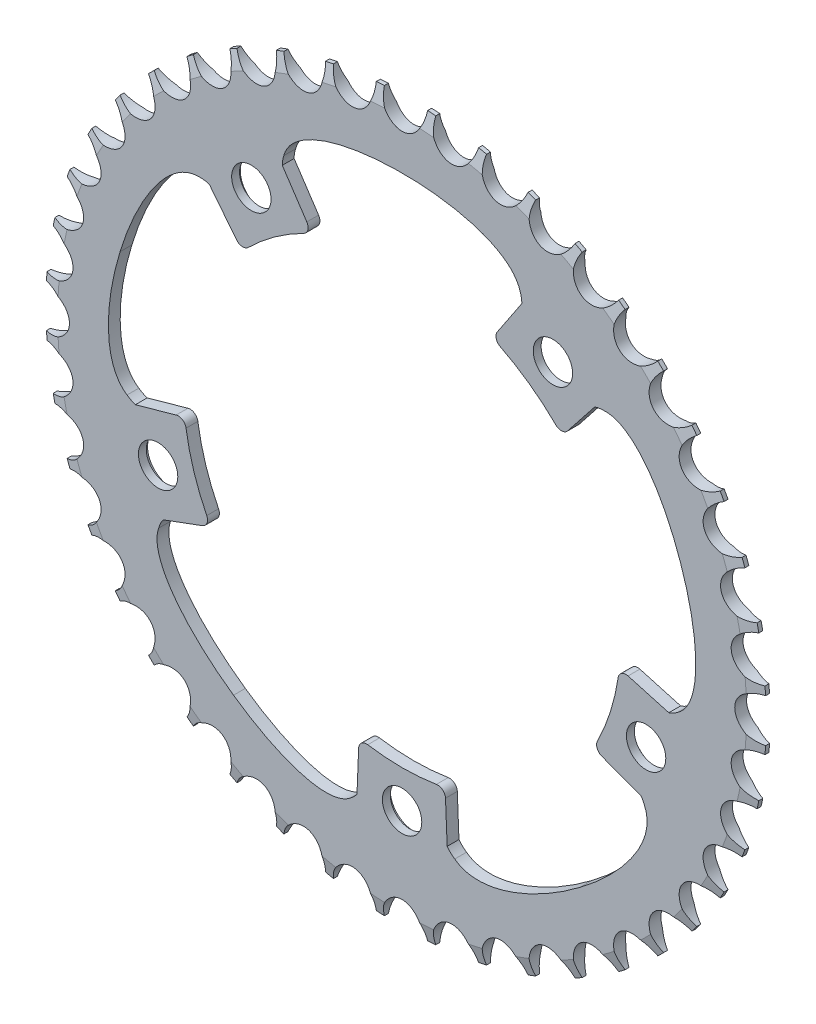
from build123d import *

# Parameters (mm, degrees)
SKETCH1_R                 = 91.5
BOSS_EXTRUDE1_DEPTH       = 3
CUT_EXTRUDE2_START        = -130.435312029
CUT_EXTRUDE2_DEPTH        = 133.435312029
CUT_EXTRUDE3_START        = -130.435312173
SKETCH6_R                 = 5
CUT_EXTRUDE3_DEPTH        = 133.435312173
SKETCH7_R                 = 6
CUT_EXTRUDE6_DEPTH        = 1
CIRPATTERN1_OUTLINE_R     = 5
CIRPATTERN1_DEPTH         = 3
CIRPATTERN1_2_OUTLINE_R   = 6
CIRPATTERN1_2_OUTLINE_R_2 = 5
CIRPATTERN1_2_DEPTH       = 1
SKETCH8_R                 = 55.5
CUT_EXTRUDE7_DEPTH        = 130.435312173
FILLET1_R                 = 2
CHAMFER1_SIZE             = 1
CHAMFER1_SIZE2            = 4
SKETCH11_RX               = 7
SKETCH11_RY               = 5.5
CUT_EXTRUDE8_DEPTH        = 130.435312031
CIRPATTERN2_COUNT         = 44


# Read off the part's stored shape, not the designer's step: CirPattern1
with BuildPart() as part:
    # Sketch1 → Boss-Extrude1 (new body)
    with BuildSketch(Plane.XY):
        Circle(SKETCH1_R)
    extrude(amount=BOSS_EXTRUDE1_DEPTH)

    # Sketch4 → Cut-Extrude2 (cut)
    with BuildSketch(Plane.XY.offset(CUT_EXTRUDE2_START)):
        with BuildLine():
            Line((0, 16.5), (30, 61.5))
            add(Edge.make_bspline(
                [(-30, 61.5), (-30, 78.833333333), (30, 78.833333333), (30, 61.5)],
                knots=[0, 0, 0, 0, 1, 1, 1, 1], degree=3))
            Line((-30, 61.5), (0, 16.5))
        make_face()
        with BuildLine():
            Line((15.692432519, 5.098780407), (49.219465921, 47.536240643))
            add(Edge.make_bspline(
                [(49.219465921, 47.536240643), (65.704445537, 52.892535212), (84.245465199, -4.170855766), (67.760485583, -9.527150335)],
                knots=[0, 0, 0, 0, 1, 1, 1, 1], degree=3))
            Line((67.760485583, -9.527150335), (15.692432519, 5.098780407))
        make_face()
        with BuildLine():
            Line((9.698456663, -13.348780407), (60.419302847, -32.120987585))
            add(Edge.make_bspline(
                [(60.419302847, -32.120987585), (70.607580554, -46.143948821), (22.066560891, -81.411063959), (11.878283185, -67.388102723)],
                knots=[0, 0, 0, 0, 1, 1, 1, 1], degree=3))
            Line((11.878283185, -67.388102723), (9.698456663, -13.348780407))
        make_face()
        with BuildLine():
            Line((-9.698456663, -13.348780407), (-11.878283185, -67.388102723))
            add(Edge.make_bspline(
                [(-11.878283185, -67.388102723), (-22.066560891, -81.411063959), (-70.607580554, -46.143948821), (-60.419302847, -32.120987585)],
                knots=[0, 0, 0, 0, 1, 1, 1, 1], degree=3))
            Line((-60.419302847, -32.120987585), (-9.698456663, -13.348780407))
        make_face()
        with BuildLine():
            Line((-15.692432519, 5.098780407), (-67.760485583, -9.527150335))
            add(Edge.make_bspline(
                [(-67.760485583, -9.527150335), (-84.245465199, -4.170855766), (-65.704445537, 52.892535212), (-49.219465921, 47.536240643)],
                knots=[0, 0, 0, 0, 1, 1, 1, 1], degree=3))
            Line((-49.219465921, 47.536240643), (-15.692432519, 5.098780407))
        make_face()
    extrude(amount=CUT_EXTRUDE2_DEPTH, mode=Mode.SUBTRACT)

    # Sketch6 → Cut-Extrude3 (cut)
    with BuildSketch(Plane.XY.offset(CUT_EXTRUDE3_START)):
        with Locations((0, -65)):
            Circle(SKETCH6_R)
    extrude(amount=CUT_EXTRUDE3_DEPTH, mode=Mode.SUBTRACT)

    # Sketch7 → Cut-Extrude6 (cut, symmetric)
    with BuildSketch(Plane.XY):
        with Locations((0, -65)):
            Circle(SKETCH7_R)
    extrude(amount=CUT_EXTRUDE6_DEPTH, both=True, mode=Mode.SUBTRACT)

    # CirPattern1 outline → CirPattern1 (cut)
    with BuildSketch(Plane.XY):
        with BuildLine():
            add(Edge.make_bspline(
                [(-48.970721556, 48.353460835), (-49.840452403, 48.636053518), (-50.71590626, 48.744900328), (-51.591637435, 48.69676138)],
                knots=[0, 0, 0, 0, 0.052758988, 0.052758988, 0.052758988, 0.052758988], degree=3))
            add(Edge.make_bspline(
                [(-51.591637435, 48.69676138), (-59.505190964, 48.838058389), (-67.53083451, 35.875195984), (-71.645584382, 22.189644727)],
                knots=[0.042157086, 0.042157086, 0.042157086, 0.042157086, 0.519094675, 0.519094675, 0.519094675, 0.519094675], degree=3))
            add(Edge.make_bspline(
                [(-71.645584382, 22.189644727), (-75.618498767, 9.294670273), (-76.153404073, -4.379467749), (-69.870454401, -8.430673202)],
                knots=[0.513223397, 0.513223397, 0.513223397, 0.513223397, 0.963256454, 0.963256454, 0.963256454, 0.963256454], degree=3))
            add(Edge.make_bspline(
                [(-49.219465921, 47.536240643), (-64.923911576, 52.638924355), (-82.494307061, 1.092905239), (-69.870454401, -8.430673202)],
                knots=[0, 0, 0, 0, 0.952651809, 0.952651809, 0.952651809, 0.952651809], degree=3))
            Line((-49.219465921, 47.536240643), (-15.82169138, 5.262392192))
            Line((-15.82169138, 5.262392192), (-15.271187724, 5.417028823))
            Line((-15.271187724, 5.417028823), (-15.625127254, 5.865034305))
            Line((-15.625127254, 5.865034305), (-15.443688154, 5.916000599))
            Line((-15.443688154, 5.916000599), (-48.970721556, 48.353460835))
        make_face()
        with BuildLine():
            Line((-9.977568221, -12.541427114), (-60.698414405, -31.313634292))
            add(Edge.make_bspline(
                [(-60.698414405, -31.313634292), (-61.23593763, -32.05347154), (-61.609987218, -32.852442122), (-61.834820174, -33.700187716)],
                knots=[0, 0, 0, 0, 0.052758988, 0.052758988, 0.052758988, 0.052758988], degree=3))
            add(Edge.make_bspline(
                [(-61.834820174, -33.700187716), (-64.414624108, -41.182761227), (-54.566269608, -52.821346574), (-42.822064563, -60.963774154)],
                knots=[0.042157086, 0.042157086, 0.042157086, 0.042157086, 0.519094675, 0.519094675, 0.519094675, 0.519094675], degree=3))
            add(Edge.make_bspline(
                [(-60.419302847, -32.120987585), (-65.648165471, -39.317899565), (-55.407832871, -52.110484893), (-42.822064563, -60.963774154)],
                knots=[0, 0, 0, 0, 0.51322341, 0.51322341, 0.51322341, 0.51322341], degree=3))
            Line((-60.419302847, -32.120987585), (-9.698456663, -13.348780407))
            Line((-9.698456663, -13.348780407), (-11.878283185, -67.388102723))
            add(Edge.make_bspline(
                [(-13.151866337, -68.737723834), (-12.678769671, -68.352063418), (-12.252636636, -67.903356045), (-11.878283185, -67.388102723)],
                knots=[0.963256454, 0.963256454, 0.963256454, 0.963256454, 1, 1, 1, 1], degree=3))
            add(Edge.make_bspline(
                [(-13.151866337, -68.737723834), (-12.507812565, -68.287276982), (-11.939434908, -67.733816152), (-11.45703839, -67.069854307)],
                knots=[0.952651809, 0.952651809, 0.952651809, 0.952651809, 1, 1, 1, 1], degree=3))
            Line((-11.45703839, -67.069854307), (-9.277211868, -13.030531991))
            Line((-9.277211868, -13.030531991), (-9.472759107, -13.102905651))
            Line((-9.472759107, -13.102905651), (-9.449712298, -12.531560215))
            Line((-9.449712298, -12.531560215), (-9.98516416, -12.729735404))
            Line((-9.98516416, -12.729735404), (-9.977568221, -12.541427114))
        make_face()
        with BuildLine():
            add(Edge.make_bspline(
                [(45.168493777, -59.246797383), (55.962125315, -51.149763796), (64.432328923, -40.401563604), (61.730554755, -33.43104458)],
                knots=[0.51322341, 0.51322341, 0.51322341, 0.51322341, 0.963256454, 0.963256454, 0.963256454, 0.963256454], degree=3))
            add(Edge.make_bspline(
                [(61.730554755, -33.43104458), (61.501177903, -32.679317316), (61.15044373, -31.967729239), (60.668047212, -31.303767393)],
                knots=[0.952651809, 0.952651809, 0.952651809, 0.952651809, 1, 1, 1, 1], degree=3))
            Line((60.668047212, -31.303767393), (9.947201028, -12.531560215))
            Line((9.947201028, -12.531560215), (9.955605049, -12.739901381))
            Line((9.955605049, -12.739901381), (9.419345105, -12.541427114))
            Line((9.419345105, -12.541427114), (9.442357185, -13.111911599))
            Line((9.442357185, -13.111911599), (9.265612633, -13.046496969))
            Line((9.265612633, -13.046496969), (11.445439154, -67.085819285))
            add(Edge.make_bspline(
                [(11.445439154, -67.085819285), (11.982962379, -67.825656533), (12.627240877, -68.428294319), (13.364017644, -68.904090962)],
                knots=[0, 0, 0, 0, 0.052758988, 0.052758988, 0.052758988, 0.052758988], degree=3))
            add(Edge.make_bspline(
                [(11.878283185, -67.388102723), (12.307791287, -67.97926991), (12.805460647, -68.482837792), (13.364017644, -68.904090962)],
                knots=[0, 0, 0, 0, 0.042157086, 0.042157086, 0.042157086, 0.042157086], degree=3))
            Line((11.878283185, -67.388102723), (9.698456663, -13.348780407))
            Line((9.698456663, -13.348780407), (60.419302847, -32.120987585))
            add(Edge.make_bspline(
                [(45.168493777, -59.246797383), (56.636176274, -50.521555053), (65.318899846, -38.864704312), (60.419302847, -32.120987585)],
                knots=[0.519094675, 0.519094675, 0.519094675, 0.519094675, 1, 1, 1, 1], degree=3))
        make_face()
        with BuildLine():
            add(Edge.make_bspline(
                [(70.082638068, -8.264350609), (76.56788967, -3.727192171), (75.441392314, 11.477338766), (70.726129666, 24.967771605)],
                knots=[0.042157086, 0.042157086, 0.042157086, 0.042157086, 0.519094677, 0.519094677, 0.519094677, 0.519094677], degree=3))
            add(Edge.make_bspline(
                [(70.726129666, 24.967771605), (66.360808725, 37.735246088), (58.756099757, 49.112264939), (51.291848086, 48.696733856)],
                knots=[0.51322341, 0.51322341, 0.51322341, 0.51322341, 0.963256454, 0.963256454, 0.963256454, 0.963256454], degree=3))
            add(Edge.make_bspline(
                [(51.291848086, 48.696733856), (50.50603164, 48.710880008), (49.720888334, 48.597204797), (48.940354363, 48.343593936)],
                knots=[0.952651809, 0.952651809, 0.952651809, 0.952651809, 1, 1, 1, 1], degree=3))
            Line((48.940354363, 48.343593936), (15.413320961, 5.9061337))
            Line((15.413320961, 5.9061337), (15.61406217, 5.849745438))
            Line((15.61406217, 5.849745438), (15.259588489, 5.401063845))
            Line((15.259588489, 5.401063845), (15.809262599, 5.246660233))
            Line((15.809262599, 5.246660233), (49.219465921, 47.536240643))
            add(Edge.make_bspline(
                [(70.082638068, -8.264350609), (82.294777329, 1.676611919), (64.83471469, 52.609942529), (49.219465921, 47.536240643)],
                knots=[0.052758988, 0.052758988, 0.052758988, 0.052758988, 1, 1, 1, 1], degree=3))
        make_face()
        with BuildLine():
            add(Edge.make_bspline(
                [(29.937835468, 64.416973245), (27.626794333, 71.986873087), (12.81831934, 75.613968888), (-1.468940981, 75.298260647)],
                knots=[0.042157086, 0.042157086, 0.042157086, 0.042157086, 0.519094675, 0.519094675, 0.519094675, 0.519094675], degree=3))
            add(Edge.make_bspline(
                [(-1.468940981, 75.298260647), (-14.960489235, 75.091960308), (-28.130661458, 71.37514446), (-30.042048529, 64.147813103)],
                knots=[0.51322341, 0.51322341, 0.51322341, 0.51322341, 0.963256454, 0.963256454, 0.963256454, 0.963256454], degree=3))
            add(Edge.make_bspline(
                [(-30.042048529, 64.147813103), (-30.298332956, 63.404828653), (-30.43284403, 62.622985423), (-30.43284403, 61.802283438)],
                knots=[0.952651809, 0.952651809, 0.952651809, 0.952651809, 1, 1, 1, 1], degree=3))
            Line((-30.43284403, 61.802283438), (-0.43284403, 16.802283438))
            Line((-0.43284403, 16.802283438), (-0.317183161, 16.975774742))
            Line((-0.317183161, 16.975774742), (-30, 61.5))
            add(Edge.make_bspline(
                [(30, 61.5), (30, 78.833333333), (-30, 78.833333333), (-30, 61.5)],
                knots=[0, 0, 0, 0, 1, 1, 1, 1], degree=3))
            Line((30, 61.5), (0.316705203, 16.975057804))
            Line((0.316705203, 16.975057804), (0.421244795, 16.818248416))
            Line((0.421244795, 16.818248416), (30.421244795, 61.818248416))
            add(Edge.make_bspline(
                [(30.421244795, 61.818248416), (30.421244795, 62.732737547), (30.254234144, 63.598979157), (29.937835468, 64.416973245)],
                knots=[0, 0, 0, 0, 0.052758988, 0.052758988, 0.052758988, 0.052758988], degree=3))
        make_face()
        with Locations((61.986421747, -19.972093698)):
            Circle(CIRPATTERN1_OUTLINE_R)
        with Locations((38.317195784, 52.894884894)):
            Circle(CIRPATTERN1_OUTLINE_R)
        with Locations((-38.297612096, 52.90124802)):
            Circle(CIRPATTERN1_OUTLINE_R)
        with Locations((-61.978941444, -19.961797944)):
            Circle(CIRPATTERN1_OUTLINE_R)
    extrude(amount=CIRPATTERN1_DEPTH, mode=Mode.SUBTRACT)

    # CirPattern1 2 outline → CirPattern1 2 (cut)
    # profile 1 of 4: a face of its own
    with BuildSketch(Plane.XY):
        with Locations((-61.667379194, -20.188200707)):
            Circle(CIRPATTERN1_2_OUTLINE_R)
        with Locations((-61.978941444, -19.961797944)):
            Circle(CIRPATTERN1_2_OUTLINE_R_2, mode=Mode.SUBTRACT)
    # profile 2 of 4: a face of its own
    with BuildSketch(Plane.XY):
        with Locations((-38.105093639, 52.308569649)):
            Circle(CIRPATTERN1_2_OUTLINE_R)
        with Locations((-38.297612096, 52.90124802)):
            Circle(CIRPATTERN1_2_OUTLINE_R_2, mode=Mode.SUBTRACT)
    # profile 3 of 4: a face of its own
    with BuildSketch(Plane.XY):
        with Locations((38.124578881, 52.30223851)):
            Circle(CIRPATTERN1_2_OUTLINE_R)
        with Locations((38.317195784, 52.894884894)):
            Circle(CIRPATTERN1_2_OUTLINE_R_2, mode=Mode.SUBTRACT)
    # profile 4 of 4: a face of its own
    with BuildSketch(Plane.XY):
        with Locations((61.674821894, -20.198444705)):
            Circle(CIRPATTERN1_2_OUTLINE_R)
        with Locations((61.986421747, -19.972093698)):
            Circle(CIRPATTERN1_2_OUTLINE_R_2, mode=Mode.SUBTRACT)
    extrude(amount=CIRPATTERN1_2_DEPTH, mode=Mode.SUBTRACT)

    # Sketch8 → Cut-Extrude7 (cut, through all)
    with BuildSketch(Plane.XY):
        Circle(SKETCH8_R)
    extrude(amount=CUT_EXTRUDE7_DEPTH, mode=Mode.SUBTRACT)

    # Fillet1
    fillet1_edges = [part.edges().sort_by_distance(p)[0] for p in [
        (22.909694928, 50.550923615, 1.5),
        (-55.175586565, -5.992048663, 1.5),
        (-48.583971365, -26.829978129, 1.5),
        (-40.635156929, 37.802566333, 1.5),
        (-22.926774769, 50.543179547, 1.5),
        (-10.946360171, -54.40980793, 1.5),
        (10.934215445, -54.41224984, 1.5),
        (55.175586565, -5.992048663, 1.5),
        (48.583342142, -26.8311175, 1.5),
        (40.622948963, 37.815684809, 1.5),
    ]]
    fillet(fillet1_edges, radius=FILLET1_R)

    # Chamfer1
    chamfer1_edges = [part.edges().sort_by_distance(p)[0] for p in [
        (-91.5, 0, 0),
        (-91.5, 0, 3),
    ]]
    chamfer1_side = [part.faces().sort_by_distance(p)[0] for p in [
        (-91.5, 0, 1.5),
    ]]
    chamfer(chamfer1_edges, length=CHAMFER1_SIZE, length2=CHAMFER1_SIZE2, reference=chamfer1_side[0])

    # Sketch11 → Cut-Extrude8 (cut, through all)
    with BuildSketch(Plane.XY):
        with Locations(Location((0, 91.5), (0, 0, -90))):
            Ellipse(SKETCH11_RX, SKETCH11_RY)
    cut_extrude8 = extrude(amount=CUT_EXTRUDE8_DEPTH, mode=Mode.SUBTRACT)

    # CirPattern2: Cut-Extrude8 ×44 about axis
    cirpattern2_axis = Axis((0, 0, 3), (0, 0, -1))
    for i in range(1, CIRPATTERN2_COUNT):
        add(cut_extrude8.rotate(cirpattern2_axis, i * 360 / CIRPATTERN2_COUNT), mode=Mode.SUBTRACT)


solid = part.part
